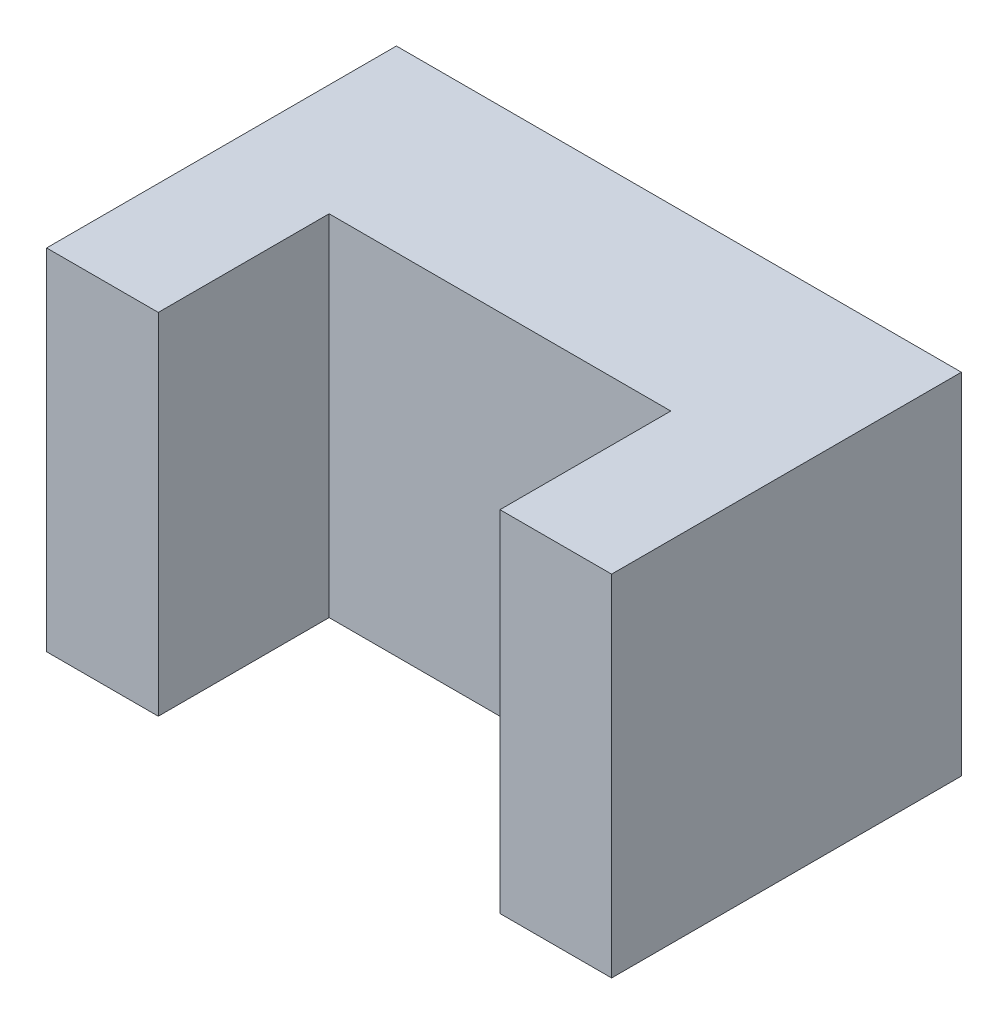
from build123d import *

# Parameters (mm, degrees)
ESQUISSE1_W             = 42
ESQUISSE1_H             = 26
BOSS_EXTRU_1_DEPTH      = 26
ESQUISSE2_W             = 25.4
ESQUISSE2_H             = 12.7
ENL_V_MAT_EXTRU_1_DEPTH = 26


with BuildPart() as part:
    # Esquisse1 → Boss.-Extru.1 (new body)
    with BuildSketch(Plane(origin=(0, 0, 0), x_dir=(1, 0, 0), z_dir=(0, 1, 0))):
        Rectangle(ESQUISSE1_W, ESQUISSE1_H)
    extrude(amount=BOSS_EXTRU_1_DEPTH)

    # Esquisse2 → Enlèv. mat.-Extru.1 (cut)
    with BuildSketch(Plane(origin=(0, 26, 0), x_dir=(1, 0, 0), z_dir=(0, 1, 0))):
        with Locations((0, -6.65)):
            Rectangle(ESQUISSE2_W, ESQUISSE2_H)
    extrude(amount=-ENL_V_MAT_EXTRU_1_DEPTH, mode=Mode.SUBTRACT)


solid = part.part
